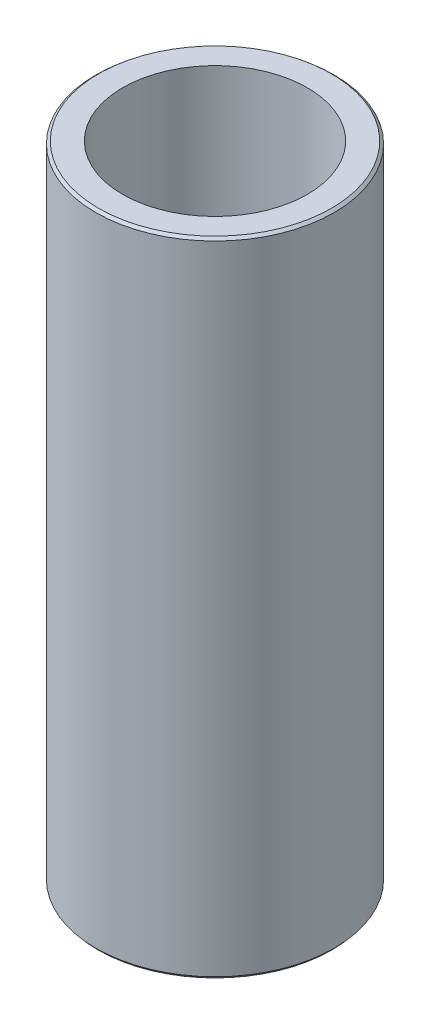
from build123d import *
from OCP.BRepFilletAPI import BRepFilletAPI_MakeChamfer

# Parameters (mm, degrees)
SKETCH1_R           = 40
BOSS_EXTRUDE1_DEPTH = 215.480341418
SKETCH2_R           = 31.007145561
CUT_EXTRUDE1_DEPTH  = 223.781905768
CHAMFER1_SIZE       = 0.782697652
CHAMFER1_SIZE2      = 0.915731512


with BuildPart() as part:
    # Sketch1 → Boss-Extrude1 (new body)
    with BuildSketch(Plane(origin=(0, 0, 0), x_dir=(1, 0, 0), z_dir=(0, 1, 0))):
        Circle(SKETCH1_R)
    extrude(amount=BOSS_EXTRUDE1_DEPTH)

    # Sketch2 → Cut-Extrude1 (cut, through all)
    with BuildSketch(Plane(origin=(0, 0, 0), x_dir=(1, 0, 0), z_dir=(0, 1, 0))):
        Circle(SKETCH2_R)
    extrude(amount=CUT_EXTRUDE1_DEPTH, mode=Mode.SUBTRACT)

    # Chamfer1: one chamfer whose edges measure the first distance from different faces: ONE call of the kernel's chamfer builder (chamfer() names one face for all edges)
    chamfer1_edges_1 = [part.edges().sort_by_distance(p)[0] for p in [
        (-40, 215.480341418, 0),
    ]]
    chamfer1_side_1 = [part.faces().sort_by_distance(p)[0] for p in [
        (-40, 107.740170709, 0),
    ]]
    chamfer1_edges_2 = [part.edges().sort_by_distance(p)[0] for p in [
        (-40, 0, 0),
    ]]
    chamfer1_side_2 = [part.faces().sort_by_distance(p)[0] for p in [
        (-38.86862915, 0, 0),
    ]]
    chamfer1 = BRepFilletAPI_MakeChamfer(part.part.solid().wrapped)
    for e in chamfer1_edges_1:
        chamfer1.Add(CHAMFER1_SIZE, CHAMFER1_SIZE2, e.wrapped, chamfer1_side_1[0].wrapped)  # the first distance lies on this face
    for e in chamfer1_edges_2:
        chamfer1.Add(CHAMFER1_SIZE, CHAMFER1_SIZE2, e.wrapped, chamfer1_side_2[0].wrapped)  # the first distance lies on this face
    add(Compound.cast(chamfer1.Shape()), mode=Mode.REPLACE)


solid = part.part
